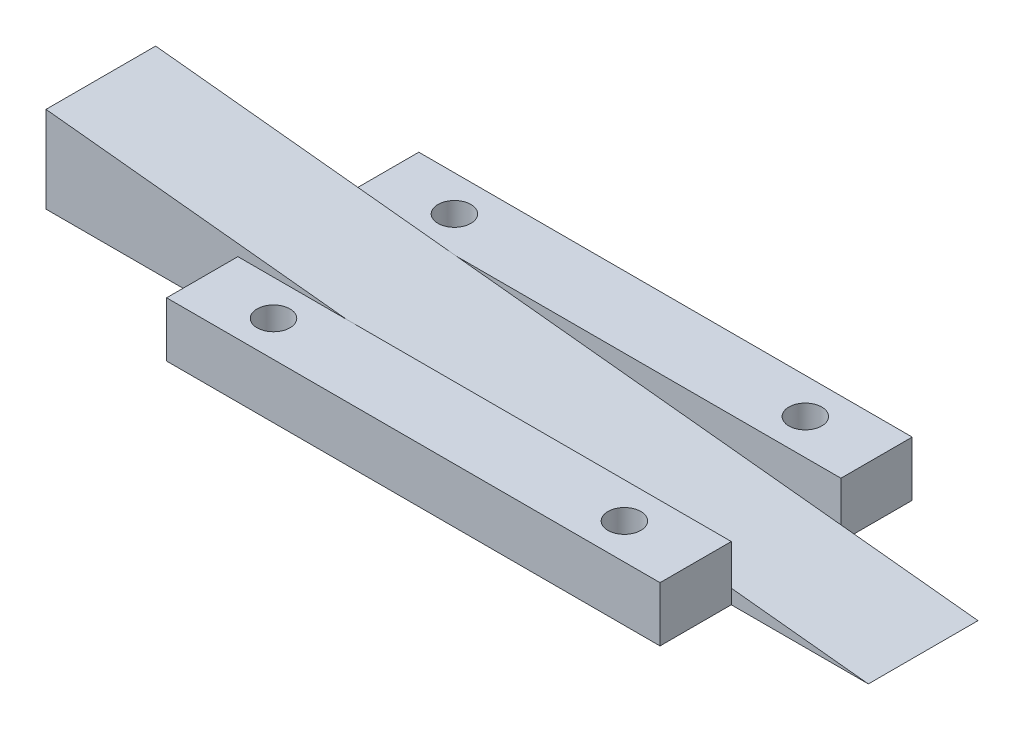
from build123d import *

# Parameters (mm, degrees)
BOSS_EXTRUDE1_DEPTH = 10
SKETCH2_W           = 90
SKETCH2_H           = 10
BOSS_EXTRUDE2_DEPTH = 13
SKETCH3_W           = 90
SKETCH3_H           = 10
BOSS_EXTRUDE3_DEPTH = 13
SKETCH4_R           = 3
CUT_EXTRUDE1_DEPTH  = 13


with BuildPart() as part:
    # Sketch1 → Boss-Extrude1 (new, symmetric)
    with BuildSketch(Plane.XY):
        Polygon((-50.147680837, 0), (99.852319163, 0), (-50.147680837, 15.76563529), align=None)
    extrude(amount=BOSS_EXTRUDE1_DEPTH, both=True)

    # Sketch2 → Boss-Extrude2 (add)
    with BuildSketch(Plane.XY.offset(10)):
        with Locations((29.852319163, 5)):
            Rectangle(SKETCH2_W, SKETCH2_H)
    extrude(amount=BOSS_EXTRUDE2_DEPTH)

    # Sketch3 → Boss-Extrude3 (add)
    with BuildSketch(Plane.XY.offset(-10)):
        with Locations((29.852319163, 5)):
            Rectangle(SKETCH3_W, SKETCH3_H)
    extrude(amount=-BOSS_EXTRUDE3_DEPTH)

    # Sketch4 → Cut-Extrude1 (cut)
    with BuildSketch(Plane(origin=(0, 10, -20), x_dir=(1, 0, 0), z_dir=(0, -1, 0))):
        with Locations((-2.147680837, 36.5)):
            Circle(SKETCH4_R)
        with Locations((61.852319163, 36.5)):
            Circle(SKETCH4_R)
        with Locations((61.852319163, 3.5)):
            Circle(SKETCH4_R)
        with Locations((-2.147680837, 3.5)):
            Circle(SKETCH4_R)
    extrude(amount=CUT_EXTRUDE1_DEPTH, mode=Mode.SUBTRACT)


solid = part.part
